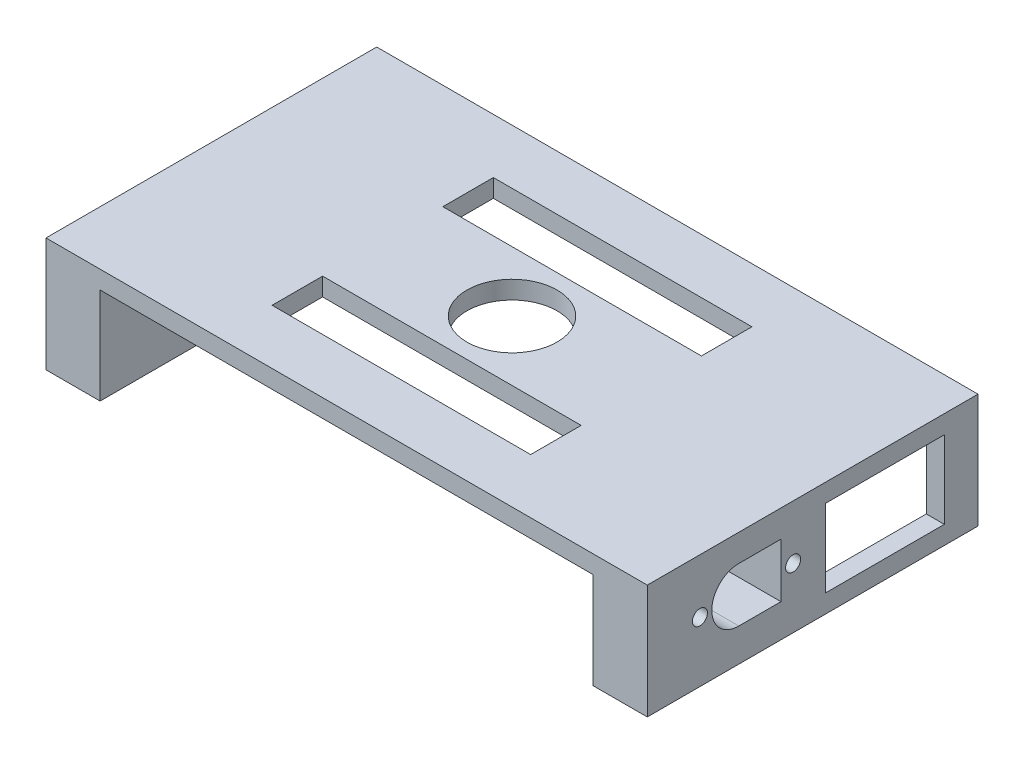
from build123d import *

# Parameters (mm, degrees)
SKETCH1_W           = 100
SKETCH1_H           = 55
BOSS_EXTRUDE1_DEPTH = 19
SKETCH2_W           = 82
SKETCH2_H           = 91
CUT_EXTRUDE1_DEPTH  = 16
CUT_EXTRUDE3_REACH  = 107.438
SKETCH3_R           = 1.25
CUT_EXTRUDE13_REACH = 107.438
SKETCH15_W          = 19.8
SKETCH15_H          = 12.9
CUT_EXTRUDE14_REACH = 62.144
SKETCH6_R           = 7.5
SKETCH6_W           = 43
SKETCH6_H           = 8.4
SKETCH16_W          = 6
SKETCH16_H          = 27.5
CUT_EXTRUDE15_DEPTH = 16


with BuildPart() as part:
    # Sketch1 → Boss-Extrude1 (new body)
    with BuildSketch(Plane(origin=(0, 0, 0), x_dir=(1, 0, 0), z_dir=(0, 1, 0))):
        Rectangle(SKETCH1_W, SKETCH1_H)
    extrude(amount=BOSS_EXTRUDE1_DEPTH)

    # Sketch2 → Cut-Extrude1 (cut)
    with BuildSketch(Plane.XZ):
        Rectangle(SKETCH2_W, SKETCH2_H)
    extrude(amount=-CUT_EXTRUDE1_DEPTH, mode=Mode.SUBTRACT)

    # Sketch3 → Cut-Extrude3 (cut, up to next)
    with BuildSketch(Plane(origin=(50, 0, 0), x_dir=(0, 0, -1), z_dir=(1, 0, 0)), mode=Mode.PRIVATE) as cut_extrude3_sk1:
        with Locations((-18.75, 10)):
            Circle(SKETCH3_R)
    cut_extrude3_tool1 = extrude(cut_extrude3_sk1.sketch, amount=-CUT_EXTRUDE3_REACH, mode=Mode.PRIVATE) & part.part
    # Sketch3 → Cut-Extrude3 (cut, up to next)
    with BuildSketch(Plane(origin=(50, 0, 0), x_dir=(0, 0, -1), z_dir=(1, 0, 0)), mode=Mode.PRIVATE) as cut_extrude3_sk2:
        with Locations((-3.25, 10)):
            Circle(SKETCH3_R)
    cut_extrude3_tool2 = extrude(cut_extrude3_sk2.sketch, amount=-CUT_EXTRUDE3_REACH, mode=Mode.PRIVATE) & part.part
    # Sketch3 → Cut-Extrude3 (cut, up to next)
    with BuildSketch(Plane(origin=(50, 0, 0), x_dir=(0, 0, -1), z_dir=(1, 0, 0)), mode=Mode.PRIVATE) as cut_extrude3_sk3:
        with BuildLine():
            Line((-5.272727273, 5.5), (-5.272727273, 14.5))
            Line((-5.272727273, 14.5), (-12.278409091, 14.5))
            ThreePointArc((-12.278409091, 14.5), (-16.778409091, 10), (-12.278409091, 5.5))
            Line((-12.278409091, 5.5), (-5.272727273, 5.5))
        make_face()
    cut_extrude3_tool3 = extrude(cut_extrude3_sk3.sketch, amount=-CUT_EXTRUDE3_REACH, mode=Mode.PRIVATE) & part.part
    add(cut_extrude3_tool1.solids().sort_by_distance((50, 10, 18.75))[0], mode=Mode.SUBTRACT)
    add(cut_extrude3_tool2.solids().sort_by_distance((50, 10, 3.25))[0], mode=Mode.SUBTRACT)
    add(cut_extrude3_tool3.solids().sort_by_distance((50, 10, 10.590569))[0], mode=Mode.SUBTRACT)

    # Sketch15 → Cut-Extrude13 (cut, up to next)
    with BuildSketch(Plane(origin=(50, 0, 0), x_dir=(0, 0, -1), z_dir=(1, 0, 0)), mode=Mode.PRIVATE) as cut_extrude13_sk1:
        with Locations((12, 9.5)):
            Rectangle(SKETCH15_W, SKETCH15_H)
    cut_extrude13_tool1 = extrude(cut_extrude13_sk1.sketch, amount=-CUT_EXTRUDE13_REACH, mode=Mode.PRIVATE) & part.part
    add(cut_extrude13_tool1.solids().sort_by_distance((50, 9.5, -12))[0], mode=Mode.SUBTRACT)

    # Sketch6 → Cut-Extrude14 (cut, up to next)
    with BuildSketch(Plane(origin=(0, 19, 0), x_dir=(1, 0, 0), z_dir=(0, 1, 0)), mode=Mode.PRIVATE) as cut_extrude14_sk1:
        Circle(SKETCH6_R)
    cut_extrude14_tool1 = extrude(cut_extrude14_sk1.sketch, amount=-CUT_EXTRUDE14_REACH, mode=Mode.PRIVATE) & part.part
    # Sketch6 → Cut-Extrude14 (cut, up to next)
    with BuildSketch(Plane(origin=(0, 19, 0), x_dir=(1, 0, 0), z_dir=(0, 1, 0)), mode=Mode.PRIVATE) as cut_extrude14_sk2:
        with Locations((0, -14.2)):
            Rectangle(SKETCH6_W, SKETCH6_H)
    cut_extrude14_tool2 = extrude(cut_extrude14_sk2.sketch, amount=-CUT_EXTRUDE14_REACH, mode=Mode.PRIVATE) & part.part
    # Sketch6 → Cut-Extrude14 (cut, up to next)
    with BuildSketch(Plane(origin=(0, 19, 0), x_dir=(1, 0, 0), z_dir=(0, 1, 0)), mode=Mode.PRIVATE) as cut_extrude14_sk3:
        with Locations((0, 14.2)):
            Rectangle(SKETCH6_W, SKETCH6_H)
    cut_extrude14_tool3 = extrude(cut_extrude14_sk3.sketch, amount=-CUT_EXTRUDE14_REACH, mode=Mode.PRIVATE) & part.part
    add(cut_extrude14_tool1.solids().sort_by_distance((0, 19, 0))[0], mode=Mode.SUBTRACT)
    add(cut_extrude14_tool2.solids().sort_by_distance((0, 19, 14.2))[0], mode=Mode.SUBTRACT)
    add(cut_extrude14_tool3.solids().sort_by_distance((0, 19, -14.2))[0], mode=Mode.SUBTRACT)

    # Sketch16 → Cut-Extrude15 (cut)
    with BuildSketch(Plane.XZ):
        with Locations((44, -13.75)):
            Rectangle(SKETCH16_W, SKETCH16_H)
    extrude(amount=-CUT_EXTRUDE15_DEPTH, mode=Mode.SUBTRACT)


solid = part.part
